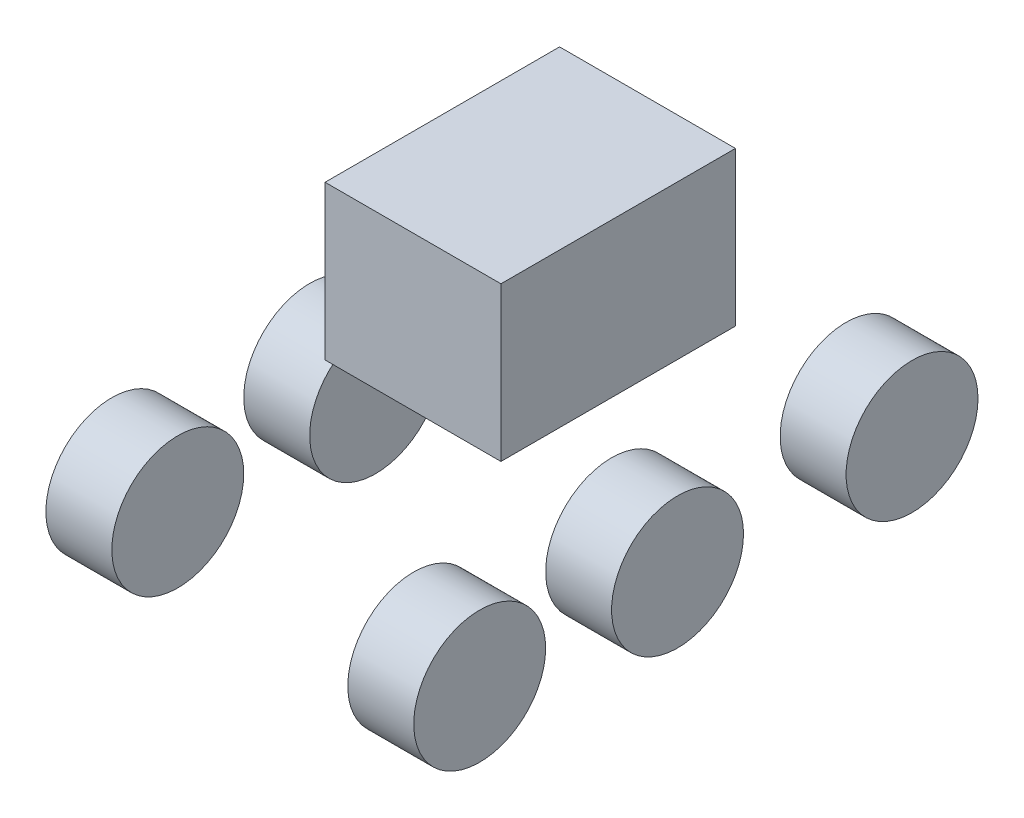
from build123d import *

# Parameters (mm, degrees)
SKETCH1_W                   = 120
SKETCH1_H                   = 160
BOSS_EXTRUDE1_DEPTH         = 105
SKETCH2_R                   = 45
BOSS_EXTRUDE2_DEPTH         = 22.5
SKETCH_PATTERN2_START       = 80.5
SKETCH_PATTERN2_OUTLINE_R   = 45
SKETCH_PATTERN2_DEPTH       = 45
SKETCH_PATTERN2_2_OUTLINE_R = 45
SKETCH_PATTERN2_2_DEPTH     = 45
SKETCH_PATTERN2_3_OUTLINE_R = 45
SKETCH_PATTERN2_3_DEPTH     = 45
SKETCH_PATTERN2_START_2     = -125.5
SKETCH_PATTERN2_4_OUTLINE_R = 45
SKETCH_PATTERN2_4_DEPTH     = 45
SKETCH_PATTERN2_5_OUTLINE_R = 45
SKETCH_PATTERN2_5_DEPTH     = 45
SKETCH_PATTERN2_6_OUTLINE_R = 45
SKETCH_PATTERN2_6_DEPTH     = 45


# Read off the part's stored shape, not the designer's step: Sketch-Pattern2
with BuildPart() as part:
    # Sketch1 → Boss-Extrude1 (new body)
    with BuildSketch(Plane(origin=(0, 0, 0), x_dir=(1, 0, 0), z_dir=(0, 1, 0))):
        Rectangle(SKETCH1_W, SKETCH1_H)
    extrude(amount=BOSS_EXTRUDE1_DEPTH)


with BuildPart() as body_2:
    # Sketch2 → Boss-Extrude2 (new, symmetric)
    with BuildSketch(Plane.ZY.offset(103)):
        with Locations(Location((-135, -60, 0), (0, 0, 180))):
            Circle(SKETCH2_R)
    extrude(amount=BOSS_EXTRUDE2_DEPTH, both=True)


with BuildPart() as body_3:
    # Sketch-Pattern2 outline → Sketch-Pattern2 (new body)
    with BuildSketch(Plane.YZ.offset(SKETCH_PATTERN2_START)):
        with Locations((-60, -135)):
            Circle(SKETCH_PATTERN2_OUTLINE_R)
    extrude(amount=SKETCH_PATTERN2_DEPTH)


with BuildPart() as body_4:
    # Sketch-Pattern2 2 outline → Sketch-Pattern2 2 (new body)
    with BuildSketch(Plane.YZ.offset(SKETCH_PATTERN2_START)):
        with Locations((-60, 25)):
            Circle(SKETCH_PATTERN2_2_OUTLINE_R)
    extrude(amount=SKETCH_PATTERN2_2_DEPTH)


with BuildPart() as body_5:
    # Sketch-Pattern2 3 outline → Sketch-Pattern2 3 (new body)
    with BuildSketch(Plane.YZ.offset(SKETCH_PATTERN2_START)):
        with Locations((-60, 160)):
            Circle(SKETCH_PATTERN2_3_OUTLINE_R)
    extrude(amount=SKETCH_PATTERN2_3_DEPTH)


with BuildPart() as body_6:
    # Sketch-Pattern2 4 outline → Sketch-Pattern2 4 (new body)
    with BuildSketch(Plane.YZ.offset(SKETCH_PATTERN2_START_2)):
        with Locations((-60, 160)):
            Circle(SKETCH_PATTERN2_4_OUTLINE_R)
    extrude(amount=SKETCH_PATTERN2_4_DEPTH)


with BuildPart() as body_7:
    # Sketch-Pattern2 5 outline → Sketch-Pattern2 5 (new body)
    with BuildSketch(Plane.YZ.offset(SKETCH_PATTERN2_START_2)):
        with Locations((-60, 25)):
            Circle(SKETCH_PATTERN2_5_OUTLINE_R)
    extrude(amount=SKETCH_PATTERN2_5_DEPTH)


with BuildPart() as body_8:
    # Sketch-Pattern2 6 outline → Sketch-Pattern2 6 (new body)
    with BuildSketch(Plane.YZ.offset(SKETCH_PATTERN2_START_2)):
        with Locations((-60, -135)):
            Circle(SKETCH_PATTERN2_6_OUTLINE_R)
    extrude(amount=SKETCH_PATTERN2_6_DEPTH)


solid = Compound([part.part, body_2.part, body_3.part, body_4.part, body_5.part, body_6.part, body_7.part, body_8.part])
